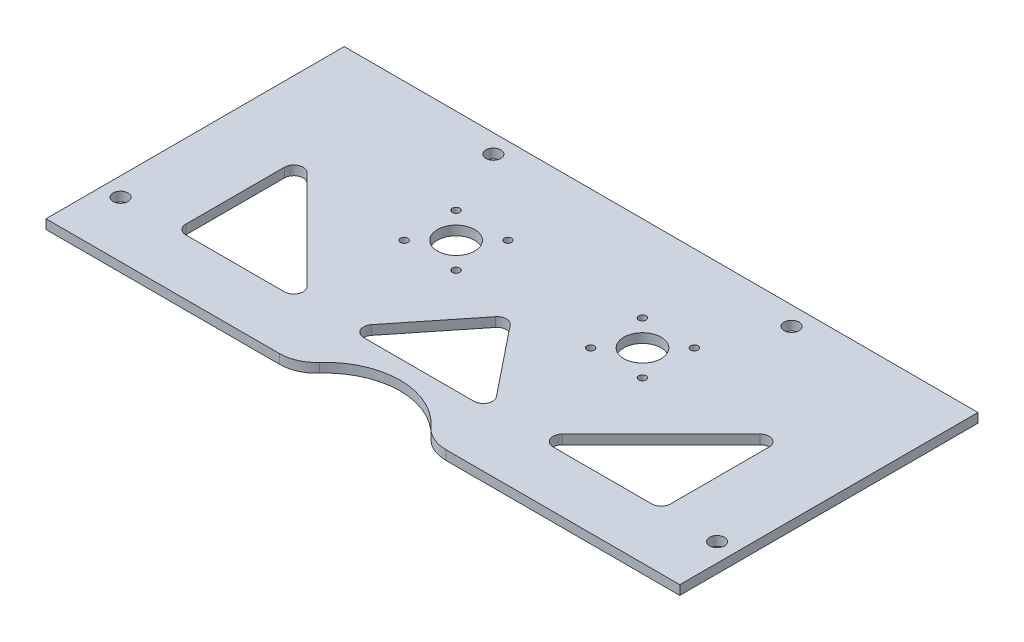
from build123d import *

# Parameters (mm, degrees)
BOSS_EXTRUDE1_DEPTH = 3.175
SKETCH2_R           = 6.35
CUT_EXTRUDE1_DEPTH  = 315.453256661
FILLET1_R           = 12.7
SKETCH3_R           = 1.27
CUT_EXTRUDE2_DEPTH  = 315.453256661
SKETCH4_R           = 2.54
CUT_EXTRUDE3_DEPTH  = 315.453256661
CUT_EXTRUDE4_DEPTH  = 315.453256661
CUT_EXTRUDE5_DEPTH  = 315.453256661
FILLET2_R           = 3.175


with BuildPart() as part:
    # Sketch1 → Boss-Extrude1 (new body)
    with BuildSketch(Plane(origin=(0, 0, 0), x_dir=(1, 0, 0), z_dir=(0, 1, 0))):
        with BuildLine():
            Line((0, 228.6), (0, 127))
            Line((0, 127), (85.952954744, 127))
            ThreePointArc((85.952954744, 127), (107.95, 139.7), (129.947045256, 127))
            Line((129.947045256, 127), (215.9, 127))
            Line((215.9, 127), (215.9, 228.6))
            Line((215.9, 228.6), (0, 228.6))
        make_face()
    extrude(amount=BOSS_EXTRUDE1_DEPTH)

    # Sketch2 → Cut-Extrude1 (cut, through all)
    with BuildSketch(Plane(origin=(0, 3.175, 0), x_dir=(1, 0, 0), z_dir=(0, 1, 0))):
        with Locations((76.2, 190.5)):
            Circle(SKETCH2_R)
        with Locations((139.7, 190.5)):
            Circle(SKETCH2_R)
    extrude(amount=-CUT_EXTRUDE1_DEPTH, mode=Mode.SUBTRACT)

    # Fillet1
    fillet1_edges = [part.edges().sort_by_distance(p)[0] for p in [
        (129.947045256, 1.5875, -127),
        (85.952954744, 1.5875, -127),
    ]]
    fillet(fillet1_edges, radius=FILLET1_R)

    # Sketch3 → Cut-Extrude2 (cut, through all)
    with BuildSketch(Plane(origin=(0, 3.175, 0), x_dir=(1, 0, 0), z_dir=(0, 1, 0))):
        with Locations((85.038834765, 199.338834765)):
            Circle(SKETCH3_R)
        with Locations((67.361165235, 181.661165235)):
            Circle(SKETCH3_R)
        with Locations((67.361165235, 199.338834765)):
            Circle(SKETCH3_R)
        with Locations((85.038834765, 181.661165235)):
            Circle(SKETCH3_R)
        with Locations((130.861165235, 181.661165235)):
            Circle(SKETCH3_R)
        with Locations((148.538834765, 181.661165235)):
            Circle(SKETCH3_R)
        with Locations((148.538834765, 199.338834765)):
            Circle(SKETCH3_R)
        with Locations((130.861165235, 199.338834765)):
            Circle(SKETCH3_R)
    extrude(amount=-CUT_EXTRUDE2_DEPTH, mode=Mode.SUBTRACT)

    # Sketch4 → Cut-Extrude3 (cut, through all)
    with BuildSketch(Plane(origin=(0, 3.175, 0), x_dir=(1, 0, 0), z_dir=(0, 1, 0))):
        with Locations((6.35, 146.05)):
            Circle(SKETCH4_R)
        with Locations((57.15, 222.25)):
            Circle(SKETCH4_R)
        with Locations((158.75, 222.25)):
            Circle(SKETCH4_R)
        with Locations((209.55, 146.05)):
            Circle(SKETCH4_R)
    extrude(amount=-CUT_EXTRUDE3_DEPTH, mode=Mode.SUBTRACT)

    # Sketch5 → Cut-Extrude4 (cut, through all)
    with BuildSketch(Plane(origin=(0, 3.175, 0), x_dir=(1, 0, 0), z_dir=(0, 1, 0))):
        Polygon((25.4, 190.5), (25.4, 146.05), (69.85, 146.05), align=None)
        Polygon((190.5, 146.05), (146.05, 146.05), (190.5, 190.5), align=None)
    extrude(amount=-CUT_EXTRUDE4_DEPTH, mode=Mode.SUBTRACT)

    # Sketch6 → Cut-Extrude5 (cut, through all)
    with BuildSketch(Plane(origin=(0, 3.175, 0), x_dir=(1, 0, 0), z_dir=(0, 1, 0))):
        Polygon((82.55, 146.05), (133.35, 146.05), (107.95, 177.8), align=None)
    extrude(amount=-CUT_EXTRUDE5_DEPTH, mode=Mode.SUBTRACT)

    # Fillet2
    fillet2_edges = [part.edges().sort_by_distance(p)[0] for p in [
        (69.85, 1.5875, -146.05),
        (25.4, 1.5875, -146.05),
        (146.05, 1.5875, -146.05),
        (190.5, 1.5875, -146.05),
        (190.5, 1.5875, -190.5),
        (25.4, 1.5875, -190.5),
        (133.35, 1.5875, -146.05),
        (82.55, 1.5875, -146.05),
        (107.95, 1.5875, -177.8),
    ]]
    fillet(fillet2_edges, radius=FILLET2_R)


solid = part.part
